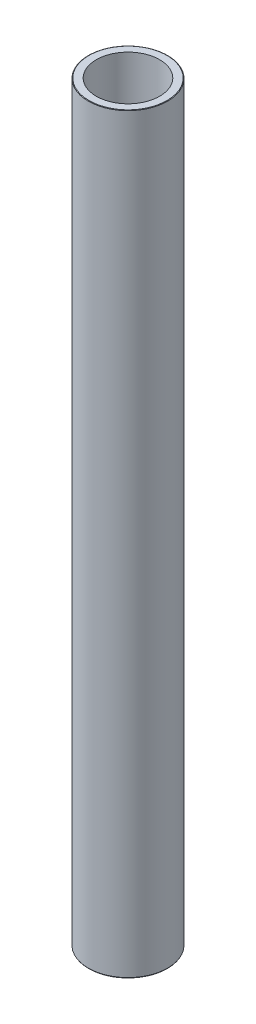
from build123d import *
from OCP.BRepFilletAPI import BRepFilletAPI_MakeChamfer

# Parameters (mm, degrees)
SKETCH1_R           = 30
BOSS_EXTRUDE1_DEPTH = 569.152457974
SKETCH2_R           = 24.007507973
CUT_EXTRUDE1_DEPTH  = 571.73156599
CHAMFER1_SIZE       = 0.25402965
CHAMFER1_SIZE2      = 0.43999226


with BuildPart() as part:
    # Sketch1 → Boss-Extrude1 (new body)
    with BuildSketch(Plane(origin=(0, 0, 0), x_dir=(1, 0, 0), z_dir=(0, 1, 0))):
        Circle(SKETCH1_R)
    extrude(amount=BOSS_EXTRUDE1_DEPTH)

    # Sketch2 → Cut-Extrude1 (cut, through all)
    with BuildSketch(Plane(origin=(0, 0, 0), x_dir=(1, 0, 0), z_dir=(0, 1, 0))):
        Circle(SKETCH2_R)
    extrude(amount=CUT_EXTRUDE1_DEPTH, mode=Mode.SUBTRACT)

    # Chamfer1: one chamfer whose edges measure the first distance from different faces: ONE call of the kernel's chamfer builder (chamfer() names one face for all edges)
    chamfer1_edges_1 = [part.edges().sort_by_distance(p)[0] for p in [
        (-30, 569.152457974, 0),
    ]]
    chamfer1_side_1 = [part.faces().sort_by_distance(p)[0] for p in [
        (-30, 284.576228987, 0),
    ]]
    chamfer1_edges_2 = [part.edges().sort_by_distance(p)[0] for p in [
        (-30, 0, 0),
    ]]
    chamfer1_side_2 = [part.faces().sort_by_distance(p)[0] for p in [
        (-29.151471863, 0, 0),
    ]]
    chamfer1 = BRepFilletAPI_MakeChamfer(part.part.solid().wrapped)
    for e in chamfer1_edges_1:
        chamfer1.Add(CHAMFER1_SIZE, CHAMFER1_SIZE2, e.wrapped, chamfer1_side_1[0].wrapped)  # the first distance lies on this face
    for e in chamfer1_edges_2:
        chamfer1.Add(CHAMFER1_SIZE, CHAMFER1_SIZE2, e.wrapped, chamfer1_side_2[0].wrapped)  # the first distance lies on this face
    add(Compound.cast(chamfer1.Shape()), mode=Mode.REPLACE)


solid = part.part
